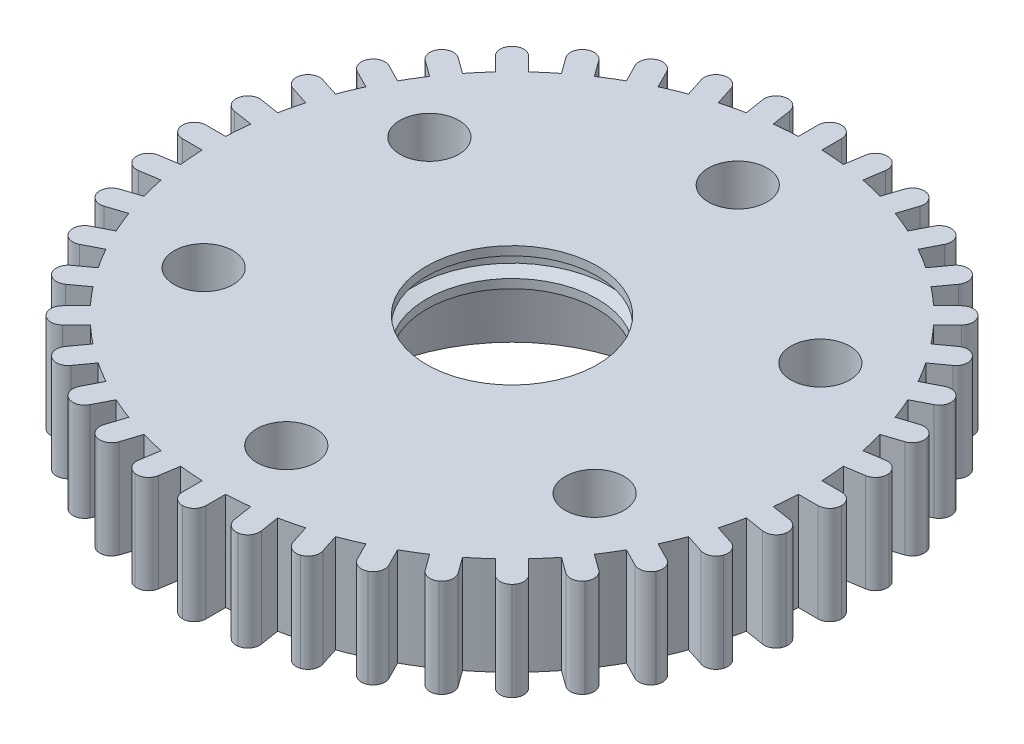
from build123d import *

# Parameters (mm, degrees)
SKETCH_2_R                       = 8.5
CUT_EXTRUDE_5_DEPTH              = 226.159943152
SKETCH_4_R                       = 15
CUT_EXTRUDE_6_DEPTH              = 25
PATTERN_CIRCULAR_1_COUNT         = 6
EXTRUDE_1_DEPTH                  = 50
FILLET_1_R                       = 6
PATTERN_CIRCULAR_2_COUNT         = 40
FILLET_1_OF_PATTERN_CIRCULAR_2_R = 6


with BuildPart() as part:
    # 草图1 → 旋转1 (revolve)
    with BuildSketch(Plane(origin=(0, 0, 0), x_dir=(0, 1, 0), z_dir=(0, 0, 1)), mode=Mode.PRIVATE) as revolve_1_sk:
        Polygon((0, 152), (0, 43.5), (-4.5, 43.5), (-6.5, 50.25), (-12.5, 50.25), (-14.5, 43.5), (-19, 43.5), (-24, 72.5), (-67, 78), (-67, 85), (-57, 85), (-57, 140), (-50, 140), (-50, 152), align=None)
    revolve(revolve_1_sk.sketch.rotate(Axis((0, -1000, 0), (0, 1, 0)), 270), axis=Axis((0, -1000, 0), (0, 1, 0)))

    # 草图2 → 切除-拉伸5 (cut, through all)
    with BuildSketch(Plane.XZ):
        with Locations(Location((0, 115, 0), (0, 0, 90))):
            Circle(SKETCH_2_R)
    cut_extrude_5 = extrude(amount=CUT_EXTRUDE_5_DEPTH, mode=Mode.SUBTRACT)

    # 草图4 → 切除-拉伸6 (cut)
    with BuildSketch(Plane(origin=(0, 0, 0), x_dir=(1, 0, 0), z_dir=(0, 1, 0))):
        with Locations(Location((0, -115, 0), (0, 0, 270))):
            Circle(SKETCH_4_R)
    cut_extrude_6 = extrude(amount=-CUT_EXTRUDE_6_DEPTH, mode=Mode.SUBTRACT)

    # 阵列(圆周)1: 切除-拉伸5, 切除-拉伸6 ×6 about axis
    pattern_circular_1_axis = Axis((0, 0, 0), (0, 1, 0))
    add([cut_extrude_5.rotate(pattern_circular_1_axis, i * 360 / PATTERN_CIRCULAR_1_COUNT) for i in range(1, PATTERN_CIRCULAR_1_COUNT)], mode=Mode.SUBTRACT)
    add([cut_extrude_6.rotate(pattern_circular_1_axis, i * 360 / PATTERN_CIRCULAR_1_COUNT) for i in range(1, PATTERN_CIRCULAR_1_COUNT)], mode=Mode.SUBTRACT)

    # 草图5 → 凸台-拉伸1 (add)
    with BuildSketch(Plane(origin=(0, 0, 0), x_dir=(1, 0, 0), z_dir=(0, 1, 0))):
        with BuildLine():
            Line((-6, 167.881532781), (-6, 151.881532781))
            ThreePointArc((-6, 151.881532781), (0, 152), (6, 151.881532781))
            Line((6, 151.881532781), (6, 167.881532781))
            Line((6, 167.881532781), (-6, 167.881532781))
        make_face()
    extrude_1 = extrude(amount=-EXTRUDE_1_DEPTH)

    # 圆角1
    fillet_1_edges = [part.edges().sort_by_distance(p)[0] for p in [
        (-6, -25, -167.881532781),
        (6, -25, -167.881532781),
    ]]
    fillet(fillet_1_edges, radius=FILLET_1_R - 0.0001)  # a hair under: the kernel refuses the full size

    # 阵列(圆周)2: 凸台-拉伸1 ×40 about axis
    pattern_circular_2_axis = Axis((0, 0, 0), (0, 1, 0))
    for i in range(1, PATTERN_CIRCULAR_2_COUNT):
        add(extrude_1.rotate(pattern_circular_2_axis, i * 360 / PATTERN_CIRCULAR_2_COUNT))

    # 圆角1 of 阵列(圆周)2
    fillet_1_of_pattern_circular_2_edges = [part.edges().sort_by_distance(p)[0] for p in [
        (-32.188587814, -25, -164.876025739),
        (-20.336327727, -25, -166.75323932),
        (-57.584585769, -25, -157.810723751),
        (-46.171907573, -25, -161.518927684),
        (-81.56266011, -25, -146.859598),
        (-70.870581819, -25, -152.307483997),
        (-103.532391067, -25, -132.292301548),
        (-93.824187135, -25, -139.345724576),
        (-122.952810953, -25, -114.467529579),
        (-114.467529579, -25, -122.952810953),
        (-139.345724576, -25, -93.824187135),
        (-132.292301548, -25, -103.532391067),
        (-152.307483997, -25, -70.870581819),
        (-146.859598, -25, -81.56266011),
        (-161.518927684, -25, -46.171907573),
        (-157.810723751, -25, -57.584585769),
        (-166.75323932, -25, -20.336327727),
        (-164.876025739, -25, -32.188587814),
        (-167.881532781, -25, 6),
        (-167.881532781, -25, -6),
        (-164.876025739, -25, 32.188587814),
        (-166.75323932, -25, 20.336327727),
        (-157.810723751, -25, 57.584585769),
        (-161.518927684, -25, 46.171907573),
        (-146.859598, -25, 81.56266011),
        (-152.307483997, -25, 70.870581819),
        (-132.292301548, -25, 103.532391067),
        (-139.345724576, -25, 93.824187135),
        (-114.467529579, -25, 122.952810953),
        (-122.952810953, -25, 114.467529579),
        (-93.824187135, -25, 139.345724576),
        (-103.532391067, -25, 132.292301548),
        (-70.870581819, -25, 152.307483997),
        (-81.56266011, -25, 146.859598),
        (-46.171907573, -25, 161.518927684),
        (-57.584585769, -25, 157.810723751),
        (-20.336327727, -25, 166.75323932),
        (-32.188587814, -25, 164.876025739),
        (6, -25, 167.881532781),
        (-6, -25, 167.881532781),
        (32.188587814, -25, 164.876025739),
        (20.336327727, -25, 166.75323932),
        (57.584585769, -25, 157.810723751),
        (46.171907573, -25, 161.518927684),
        (81.56266011, -25, 146.859598),
        (70.870581819, -25, 152.307483997),
        (103.532391067, -25, 132.292301548),
        (93.824187135, -25, 139.345724576),
        (122.952810953, -25, 114.467529579),
        (114.467529579, -25, 122.952810953),
        (139.345724576, -25, 93.824187135),
        (132.292301548, -25, 103.532391067),
        (152.307483997, -25, 70.870581819),
        (146.859598, -25, 81.56266011),
        (161.518927684, -25, 46.171907573),
        (157.810723751, -25, 57.584585769),
        (166.75323932, -25, 20.336327727),
        (164.876025739, -25, 32.188587814),
        (167.881532781, -25, -6),
        (167.881532781, -25, 6),
        (164.876025739, -25, -32.188587814),
        (166.75323932, -25, -20.336327727),
        (157.810723751, -25, -57.584585769),
        (161.518927684, -25, -46.171907573),
        (146.859598, -25, -81.56266011),
        (152.307483997, -25, -70.870581819),
        (132.292301548, -25, -103.532391067),
        (139.345724576, -25, -93.824187135),
        (114.467529579, -25, -122.952810953),
        (122.952810953, -25, -114.467529579),
        (93.824187135, -25, -139.345724576),
        (103.532391067, -25, -132.292301548),
        (70.870581819, -25, -152.307483997),
        (81.56266011, -25, -146.859598),
        (46.171907573, -25, -161.518927684),
        (57.584585769, -25, -157.810723751),
        (20.336327727, -25, -166.75323932),
        (32.188587814, -25, -164.876025739),
    ]]
    fillet(fillet_1_of_pattern_circular_2_edges, radius=FILLET_1_OF_PATTERN_CIRCULAR_2_R - 0.0001)  # a hair under: the kernel refuses the full size


solid = part.part
